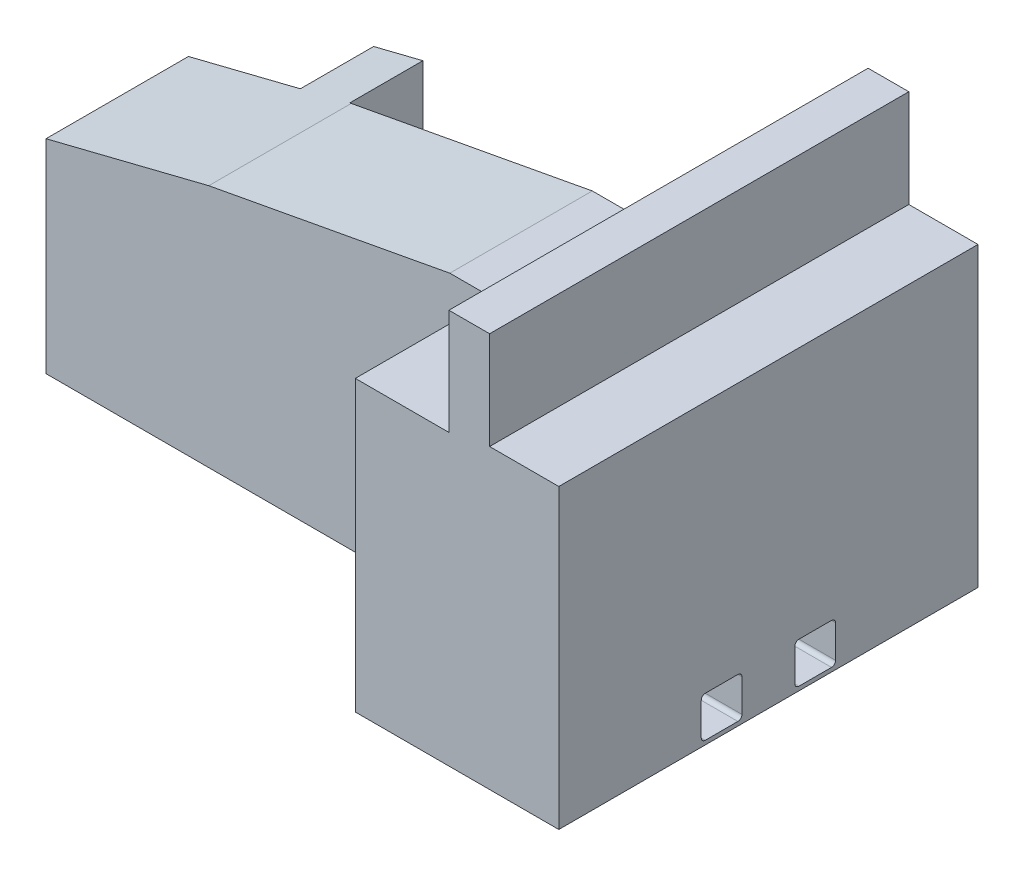
from build123d import *

# Parameters (mm, degrees)
BOSS_EXTRUDE1_DEPTH     = 970
CUT_EXTRUDE1_DEPTH      = 1359.721825835
CUT_EXTRUDE1_DEPTH_BACK = 1359.721825835
CUT_EXTRUDE5_DEPTH      = 1625
SKETCH4_R               = 8.5
CUT_EXTRUDE6_DEPTH      = 78
SKETCH5_W               = 170
SKETCH5_H               = 240
SKETCH5_W_2             = 375
SKETCH5_H_2             = 260
CUT_EXTRUDE8_DEPTH      = 1478


with BuildPart() as part:
    # Sketch2 → Boss-Extrude1 (new body)
    with BuildSketch(Plane(origin=(0, 0, 0), x_dir=(1, 0, 0), z_dir=(0, 1, 0))):
        Polygon((300, -515), (800, -515), (800, 515), (300, 515), (300, 175), (-404, 175), (-404, 355), (-525, 355), (-525, 175), (-800, 175), (-800, -175), (300, -175), align=None)
    extrude(amount=BOSS_EXTRUDE1_DEPTH)

    # Sketch1 → Cut-Extrude1 (cut, two sides: drawn at the far end of the back side and taken through both)
    with BuildSketch(Plane.XY.offset(-CUT_EXTRUDE1_DEPTH_BACK)):
        Polygon((-800, 970), (-800, 500), (-400, 600), (300, 730), (530, 970), align=None)
    extrude(amount=CUT_EXTRUDE1_DEPTH + CUT_EXTRUDE1_DEPTH_BACK, mode=Mode.SUBTRACT)

    # Sketch3 → Cut-Extrude5 (cut)
    with BuildSketch(Plane.ZY.offset(800)):
        with BuildLine():
            ThreePointArc((-155, 110), (-162.071067812, 107.071067812), (-165, 100))
            Line((-165, 100), (-165, 20))
            ThreePointArc((-165, 20), (-162.071067812, 12.928932188), (-155, 10))
            Line((-155, 10), (-75, 10))
            ThreePointArc((-75, 10), (-67.928932188, 12.928932188), (-65, 20))
            Line((-65, 20), (-65, 100))
            ThreePointArc((-65, 100), (-67.928932188, 107.071067812), (-75, 110))
            Line((-75, 110), (-155, 110))
        make_face()
        with BuildLine():
            Line((155, 110), (75, 110))
            ThreePointArc((75, 110), (67.928932188, 107.071067812), (65, 100))
            Line((65, 100), (65, 20))
            ThreePointArc((65, 20), (67.928932188, 12.928932188), (75, 10))
            Line((75, 10), (155, 10))
            ThreePointArc((155, 10), (162.071067812, 12.928932188), (165, 20))
            Line((165, 20), (165, 100))
            ThreePointArc((165, 100), (162.071067812, 107.071067812), (155, 110))
        make_face()
    extrude(amount=-CUT_EXTRUDE5_DEPTH, mode=Mode.SUBTRACT)

    # Sketch4 → Cut-Extrude6 (cut)
    with BuildSketch(Plane.XZ):
        with Locations((-498.5, 115)):
            Circle(SKETCH4_R)
        with Locations((-501, -115)):
            Circle(SKETCH4_R)
        with Locations((501, -115)):
            Circle(SKETCH4_R)
        with Locations((498.5, 115)):
            Circle(SKETCH4_R)
    extrude(amount=-CUT_EXTRUDE6_DEPTH, mode=Mode.SUBTRACT)

    # Sketch5 → Cut-Extrude8 (cut)
    with BuildSketch(Plane.XY.offset(515)):
        with Locations((715, 850)):
            Rectangle(SKETCH5_W, SKETCH5_H)
        with Locations((342.5, 840)):
            Rectangle(SKETCH5_W_2, SKETCH5_H_2)
    extrude(amount=-CUT_EXTRUDE8_DEPTH, mode=Mode.SUBTRACT)


solid = part.part
